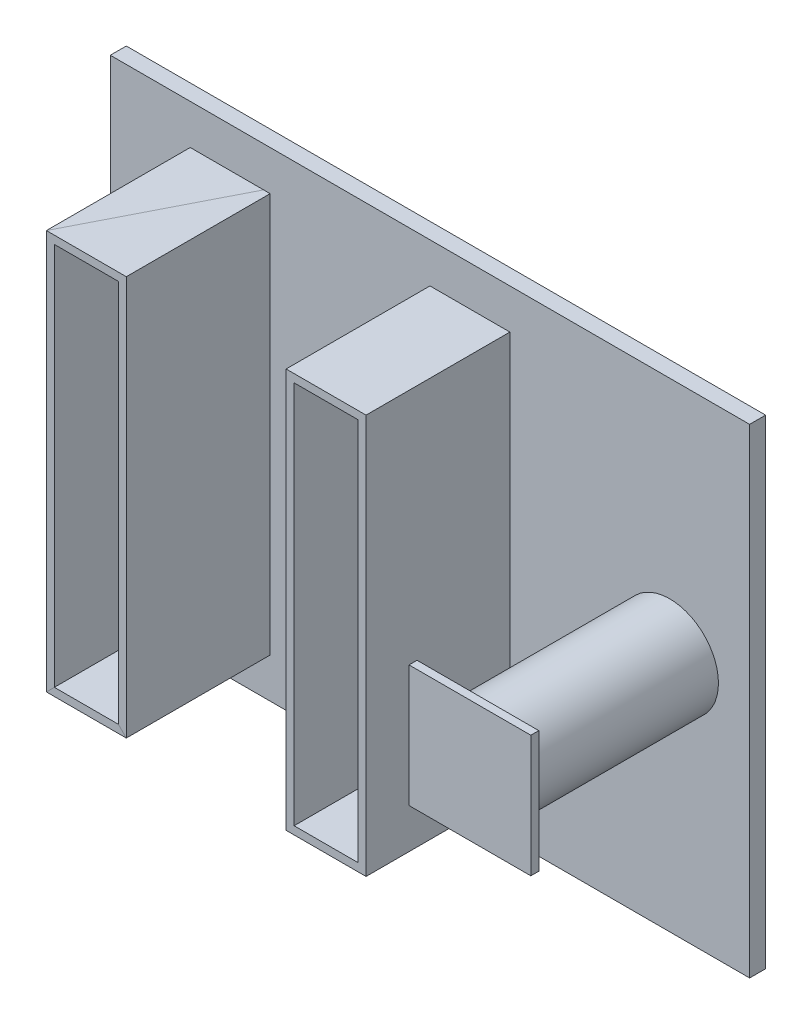
from build123d import *

# Parameters (mm, degrees)
SKETCH2_W                = 400
SKETCH2_H                = 300
BOSS_EXTRUDE1_DEPTH      = 10
SKETCH3_W                = 50
SKETCH3_H                = 250
BOSS_EXTRUDE2_DEPTH      = 100
SKETCH7_W                = 50
SKETCH7_H                = 250
BOSS_EXTRUDE3_DEPTH      = 98
SKETCH9_W                = 40
SKETCH9_H                = 240
CUT_EXTRUDE2_DEPTH       = 98
SKETCH11_W               = 40
SKETCH11_H               = 240
CUT_EXTRUDE3_DEPTH       = 98
SKETCH12_R               = 30.48
BOSS_EXTRUDE4_DEPTH      = 120
SKETCH13_W               = 76.2
SKETCH13_H               = 76.2
BOSS_EXTRUDE5_DEPTH      = 5
SKETCH14_R               = 18.088772669
BOSS_EXTRUDE6_DEPTH      = 20
BOSS_EXTRUDE6_TAPER      = 30
SKETCH20_R               = 6.541767286
SKETCH20_R_2             = 3.441767286
EXTRUDE_THIN2_DEPTH      = 20
CUT_EXTRUDE6_START       = -30
SKETCH22_R               = 3.441767286
CUT_EXTRUDE6_DEPTH       = 30
SKETCH23_R               = 5
SKETCH23_R_2             = 2
EXTRUDE_THIN3_DEPTH      = 15
BOSS_EXTRUDE11_START     = -200
BOSS_EXTRUDE11_OUTLINE_R = 5
BOSS_EXTRUDE11_DEPTH     = 100


# Read off the part's stored shape, not the designer's step: Boss-Extrude11
with BuildPart() as part:
    # Sketch2 → Boss-Extrude1 (new body)
    with BuildSketch(Plane.XY):
        with Locations((200, -150)):
            Rectangle(SKETCH2_W, SKETCH2_H)
    extrude(amount=BOSS_EXTRUDE1_DEPTH)

    # Sketch3 → Boss-Extrude2 (add)
    with BuildSketch(Plane.XY):
        with Locations((75, -150)):
            Rectangle(SKETCH3_W, SKETCH3_H)
        with Locations((225, -150)):
            Rectangle(SKETCH3_W, SKETCH3_H)
    extrude(amount=BOSS_EXTRUDE2_DEPTH)


with BuildPart() as body_2:
    # Sketch7 → Boss-Extrude3 (new body)
    with BuildSketch(Plane.XY.offset(100)):
        with Locations((75, -150)):
            Rectangle(SKETCH7_W, SKETCH7_H)
    extrude(amount=-BOSS_EXTRUDE3_DEPTH)


with BuildPart() as cut_extrude2_tool:
    # Sketch9 → Cut-Extrude2 (new body)
    with BuildSketch(Plane.XY.offset(100)):
        with Locations((75, -150)):
            Rectangle(SKETCH9_W, SKETCH9_H)
    extrude(amount=-CUT_EXTRUDE2_DEPTH)


with BuildPart() as part_1:
    add(part.part)

    # Cut-Extrude2: cut by cut_extrude2_tool
    add(cut_extrude2_tool.part, mode=Mode.SUBTRACT)

    # Sketch11 → Cut-Extrude3 (cut)
    with BuildSketch(Plane.XY.offset(100)):
        with Locations((225, -150)):
            Rectangle(SKETCH11_W, SKETCH11_H)
    extrude(amount=-CUT_EXTRUDE3_DEPTH, mode=Mode.SUBTRACT)

    # Sketch12 → Boss-Extrude4 (add)
    with BuildSketch(Plane.XY.offset(10)):
        with Locations((350, -150)):
            Circle(SKETCH12_R)
    extrude(amount=BOSS_EXTRUDE4_DEPTH)

    # Sketch13 → Boss-Extrude5 (add)
    with BuildSketch(Plane.XY.offset(130)):
        with Locations((350, -150)):
            Rectangle(SKETCH13_W, SKETCH13_H)
    extrude(amount=BOSS_EXTRUDE5_DEPTH)

    # Sketch14 → Boss-Extrude6 (add)
    with BuildSketch(Plane(origin=(0, 0, 0), x_dir=(-1, 0, 0), z_dir=(0, 0, -1))):
        with Locations((-75, -150)):
            Circle(SKETCH14_R)
    extrude(amount=BOSS_EXTRUDE6_DEPTH, taper=BOSS_EXTRUDE6_TAPER)

    # Sketch20 → Extrude-Thin2 (add)
    with BuildSketch(Plane(origin=(0, 0, -20), x_dir=(-1, 0, 0), z_dir=(0, 0, -1))):
        with Locations((-75, -150)):
            Circle(SKETCH20_R)
        with Locations((-75, -150)):
            Circle(SKETCH20_R_2, mode=Mode.SUBTRACT)
    extrude(amount=EXTRUDE_THIN2_DEPTH)

    # Sketch22 → Cut-Extrude6 (cut)
    with BuildSketch(Plane(origin=(0, 0, -20), x_dir=(-1, 0, 0), z_dir=(0, 0, -1)).offset(CUT_EXTRUDE6_START)):
        with Locations(Location((-75, -150, 0), (0, 0, 180))):
            Circle(SKETCH22_R)
    extrude(amount=CUT_EXTRUDE6_DEPTH, mode=Mode.SUBTRACT)

    # Sketch23 → Extrude-Thin3 (add)
    with BuildSketch(Plane(origin=(0, 0, 0), x_dir=(-1, 0, 0), z_dir=(0, 0, -1))):
        with Locations((-225, -150)):
            Circle(SKETCH23_R)
        with Locations((-225, -150)):
            Circle(SKETCH23_R_2, mode=Mode.SUBTRACT)
    extrude(amount=EXTRUDE_THIN3_DEPTH)


with BuildPart() as body_2_1:
    add(body_2.part)

    # Cut-Extrude2: cut by cut_extrude2_tool
    add(cut_extrude2_tool.part, mode=Mode.SUBTRACT)


with BuildPart() as body_3:
    # Boss-Extrude11 outline → Boss-Extrude11 (new body)
    with BuildSketch(Plane(origin=(0, 0, 0), x_dir=(1, 0, 0), z_dir=(0, 1, 0)).offset(BOSS_EXTRUDE11_START)):
        with Locations((225, 15)):
            Circle(BOSS_EXTRUDE11_OUTLINE_R)
    extrude(amount=BOSS_EXTRUDE11_DEPTH)


solid = Compound([part_1.part, body_2_1.part, body_3.part])
